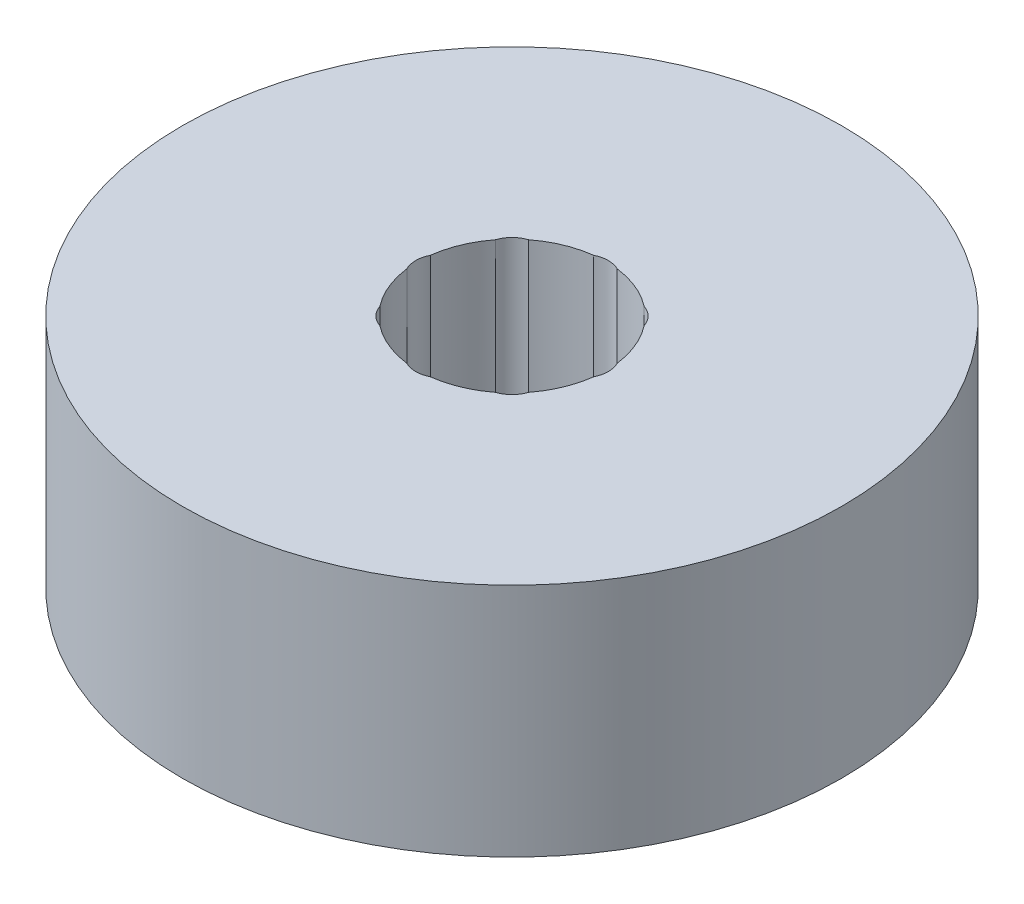
from build123d import *

# Parameters (mm, degrees)
SKETCH1_R           = 35
BOSS_EXTRUDE1_DEPTH = 25
SKETCH2_R           = 10
CUT_EXTRUDE1_DEPTH  = 56.452682532
SKETCH3_R           = 2.777390055
CUT_EXTRUDE2_DEPTH  = 18.363630356
CIRPATTERN1_COUNT   = 8


with BuildPart() as part:
    # Sketch1 → Boss-Extrude1 (new body)
    with BuildSketch(Plane(origin=(0, 0, 0), x_dir=(1, 0, 0), z_dir=(0, 1, 0))):
        Circle(SKETCH1_R)
    extrude(amount=BOSS_EXTRUDE1_DEPTH)

    # Sketch2 → Cut-Extrude1 (cut, through all)
    with BuildSketch(Plane(origin=(0, 0, 0), x_dir=(1, 0, 0), z_dir=(0, 1, 0))):
        Circle(SKETCH2_R)
    extrude(amount=CUT_EXTRUDE1_DEPTH, mode=Mode.SUBTRACT)

    # Sketch3 → Cut-Extrude2 (cut)
    with BuildSketch(Plane(origin=(0, 25, 0), x_dir=(1, 0, 0), z_dir=(0, 1, 0))):
        with Locations((-7.440479207, 0)):
            Circle(SKETCH3_R)
    cut_extrude2 = extrude(amount=-CUT_EXTRUDE2_DEPTH, mode=Mode.SUBTRACT)

    # CirPattern1: Cut-Extrude2 ×8 about axis
    cirpattern1_axis = Axis((0, 0, 0), (0, 1, 0))
    for i in range(1, CIRPATTERN1_COUNT):
        add(cut_extrude2.rotate(cirpattern1_axis, i * 360 / CIRPATTERN1_COUNT), mode=Mode.SUBTRACT)


solid = part.part
